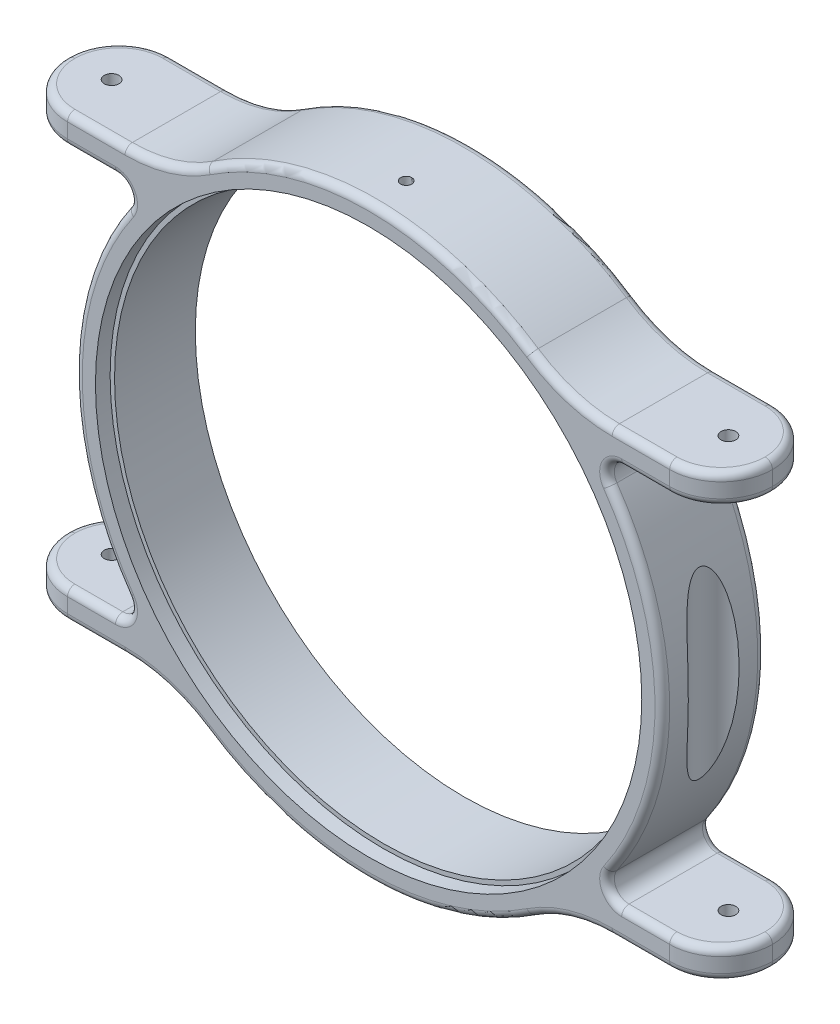
from build123d import *

# Parameters (mm, degrees)
BOSS_EXTRUDE1_DEPTH             = 2
BOSS_EXTRUDE1_DEPTH_BACK        = 5
SKETCH1_R                       = 20
SKETCH1_R_2                     = 18.3
SKETCH2_R                       = 19.3
CUT_EXTRUDE1_DEPTH              = 0.5
CUT_EXTRUDE9_DEPTH              = 34.077823777
BOSS_EXTRUDE2_REACH             = 30.723
BOSS_EXTRUDE2_DIRECTION_2_REACH = 30.723
FILLET4_R                       = 10
CUT_EXTRUDE12_DEPTH             = 32.638584118
CUT_EXTRUDE12_DEPTH_BACK        = 32.638584118
FILLET5_R                       = 1
FILLET6_R                       = 3.5
FILLET7_R                       = 0.5
CUT_EXTRUDE13_DEPTH             = 32.638584194
CUT_EXTRUDE13_DEPTH_BACK        = 32.638584194
SKETCH10_R                      = 0.5
SKETCH11_R                      = 18.6
CUT_EXTRUDE14_DEPTH             = 1
CUT_EXTRUDE16_REACH             = 43.11
SKETCH13_R                      = 2


with BuildPart() as part:
    # Sketch1 → Boss-Extrude1 (new, two sides: drawn at the far end of the back side and taken through both)
    with BuildSketch(Plane(origin=(0, 0, 0), x_dir=(-1, 0, 0), z_dir=(0, 0, -1)).offset(-BOSS_EXTRUDE1_DEPTH_BACK)):
        Circle(SKETCH1_R)
        Circle(SKETCH1_R_2, mode=Mode.SUBTRACT)
    extrude(amount=BOSS_EXTRUDE1_DEPTH + BOSS_EXTRUDE1_DEPTH_BACK)

    # Sketch2 → Cut-Extrude1 (cut)
    with BuildSketch(Plane(origin=(0, 0, -2), x_dir=(-1, 0, 0), z_dir=(0, 0, -1))):
        Circle(SKETCH2_R)
    extrude(amount=-CUT_EXTRUDE1_DEPTH, mode=Mode.SUBTRACT)

    # Sketch5 → Cut-Extrude9 (cut, through all)
    with BuildSketch(Plane(origin=(-1.350190497, 4.228871819, -2.160555979), x_dir=(1, 0, 0), z_dir=(0, 1, 0))):
        with BuildLine():
            add(Edge.make_bspline(
                [(1.350190497, -4.982788569), (1.470272407, -4.982788569), (1.590466354, -4.935768225), (1.685402744, -4.840719798), (1.779443431, -4.600555979), (1.685402744, -4.360392159), (1.590466354, -4.265343732), (1.470272407, -4.218323388), (1.350190497, -4.218323388)],
                knots=[4.921389743, 4.921389743, 4.921389743, 4.921389743, 4.921389743, 4.921389743, 7.382084615, 7.382084615, 7.382084615, 9.842779486, 9.842779486, 9.842779486, 9.842779486, 9.842779486, 9.842779486], degree=5))
            add(Edge.make_bspline(
                [(1.350190497, -4.218323388), (1.230108588, -4.218323388), (1.109914641, -4.265343732), (1.014978251, -4.360392159), (0.920937563, -4.600555979), (1.014978251, -4.840719798), (1.109914641, -4.935768225), (1.230108588, -4.982788569), (1.350190497, -4.982788569)],
                knots=[0, 0, 0, 0, 0, 0, 2.460694872, 2.460694872, 2.460694872, 4.921389743, 4.921389743, 4.921389743, 4.921389743, 4.921389743, 4.921389743], degree=5))
        make_face()
    extrude(amount=CUT_EXTRUDE9_DEPTH, mode=Mode.SUBTRACT)

    # Boss-Extrude2: up to this face of the body (flat: up to its plane)
    boss_extrude2_end = Plane(part.part.faces().sort_by_distance((19.434314575, 0, 5))[0])
    # Sketch6 → Boss-Extrude2 (add, up to the picked face)
    with BuildSketch(Plane.XY, mode=Mode.PRIVATE) as boss_extrude2_sk1:
        with BuildLine():
            ThreePointArc((-13.228756555, -15), (-20, 0), (-13.228756555, 15))
            Line((-13.228756555, 15), (-24, 15))
            Line((-24, 15), (-24, -15))
            Line((-24, -15), (-13.228756555, -15))
        make_face()
    boss_extrude2_tool1 = split(extrude(boss_extrude2_sk1.sketch, amount=BOSS_EXTRUDE2_REACH, mode=Mode.PRIVATE), bisect_by=boss_extrude2_end, keep=Keep.BOTH, mode=Mode.PRIVATE)
    # Sketch6 → Boss-Extrude2 (add, up to the picked face)
    with BuildSketch(Plane.XY, mode=Mode.PRIVATE) as boss_extrude2_sk2:
        with BuildLine():
            Line((24, 15), (13.228756555, 15))
            ThreePointArc((13.228756555, 15), (18.228756555, 8.228756555), (20, 0))
            ThreePointArc((20, 0), (18.228756555, -8.228756555), (13.228756555, -15))
            Line((13.228756555, -15), (24, -15))
            Line((24, -15), (24, 15))
        make_face()
    boss_extrude2_tool2 = split(extrude(boss_extrude2_sk2.sketch, amount=BOSS_EXTRUDE2_REACH, mode=Mode.PRIVATE), bisect_by=boss_extrude2_end, keep=Keep.BOTH, mode=Mode.PRIVATE)
    add(boss_extrude2_tool1.solids().sort_by(Axis((-20.647807, 0, 0), (0, 0, 1)))[0])
    add(boss_extrude2_tool2.solids().sort_by(Axis((20.647807, 0, 0), (0, 0, 1)))[0])

    # Boss-Extrude2 direction 2: up to this face of the body (flat: up to its plane)
    boss_extrude2_direction_2_end = Plane(part.part.faces().sort_by_distance((19.434314575, 0, -2))[0])
    # Sketch6 → Boss-Extrude2 direction 2 (add, up to the picked face)
    with BuildSketch(Plane.XY, mode=Mode.PRIVATE) as boss_extrude2_direction_2_sk1:
        with BuildLine():
            ThreePointArc((-13.228756555, -15), (-20, 0), (-13.228756555, 15))
            Line((-13.228756555, 15), (-24, 15))
            Line((-24, 15), (-24, -15))
            Line((-24, -15), (-13.228756555, -15))
        make_face()
    boss_extrude2_direction_2_tool1 = split(extrude(boss_extrude2_direction_2_sk1.sketch, amount=-BOSS_EXTRUDE2_DIRECTION_2_REACH, mode=Mode.PRIVATE), bisect_by=boss_extrude2_direction_2_end, keep=Keep.BOTH, mode=Mode.PRIVATE)
    # Sketch6 → Boss-Extrude2 direction 2 (add, up to the picked face)
    with BuildSketch(Plane.XY, mode=Mode.PRIVATE) as boss_extrude2_direction_2_sk2:
        with BuildLine():
            Line((24, 15), (13.228756555, 15))
            ThreePointArc((13.228756555, 15), (18.228756555, 8.228756555), (20, 0))
            ThreePointArc((20, 0), (18.228756555, -8.228756555), (13.228756555, -15))
            Line((13.228756555, -15), (24, -15))
            Line((24, -15), (24, 15))
        make_face()
    boss_extrude2_direction_2_tool2 = split(extrude(boss_extrude2_direction_2_sk2.sketch, amount=-BOSS_EXTRUDE2_DIRECTION_2_REACH, mode=Mode.PRIVATE), bisect_by=boss_extrude2_direction_2_end, keep=Keep.BOTH, mode=Mode.PRIVATE)
    add(boss_extrude2_direction_2_tool1.solids().sort_by(Axis((-20.647807, 0, 0), (0, 0, -1)))[0])
    add(boss_extrude2_direction_2_tool2.solids().sort_by(Axis((20.647807, 0, 0), (0, 0, -1)))[0])

    # Fillet4
    fillet4_edges = [part.edges().sort_by_distance(p)[0] for p in [
        (-13.228756555, 15, 1.5),
        (-13.228756555, -15, 1.5),
        (13.228756555, 15, 1.5),
        (13.228756555, -15, 1.5),
    ]]
    fillet(fillet4_edges, radius=FILLET4_R)

    # Sketch9 → Cut-Extrude12 (cut, two sides: drawn at the far end of the back side and taken through both)
    with BuildSketch(Plane.XY.offset(-CUT_EXTRUDE12_DEPTH_BACK)):
        with BuildLine():
            Line((24, -13), (24, 13))
            Line((24, 13), (16.583123952, 13))
            Line((16.583123952, 13), (15.198684154, 13))
            ThreePointArc((15.198684154, 13), (20, 0), (15.198684154, -13))
            Line((15.198684154, -13), (16.583123952, -13))
            Line((16.583123952, -13), (24, -13))
        make_face()
        with BuildLine():
            Line((-15.198684154, 13), (-16.583123952, 13))
            Line((-16.583123952, 13), (-24, 13))
            Line((-24, 13), (-24, -13))
            Line((-24, -13), (-16.583123952, -13))
            Line((-16.583123952, -13), (-15.198684154, -13))
            ThreePointArc((-15.198684154, -13), (-20, 0), (-15.198684154, 13))
        make_face()
    extrude(amount=CUT_EXTRUDE12_DEPTH + CUT_EXTRUDE12_DEPTH_BACK, mode=Mode.SUBTRACT)

    # Fillet5
    fillet5_edges = [part.edges().sort_by_distance(p)[0] for p in [
        (-15.198684154, 13, 1.5),
        (-15.198684154, -13, 1.5),
        (15.198684154, -13, 1.5),
        (15.198684154, 13, 1.5),
    ]]
    fillet(fillet5_edges, radius=FILLET5_R)

    # Fillet6
    fillet6_edges = [part.edges().sort_by_distance(p)[0] for p in [
        (-24, 14, 5),
        (-24, 14, -2),
        (-24, -14, 5),
        (-24, -14, -2),
        (24, -14, 5),
        (24, -14, -2),
        (24, 14, 5),
        (24, 14, -2),
    ]]
    fillet(fillet6_edges, radius=FILLET6_R - 0.0001)  # a hair under: the kernel refuses the full size

    # Fillet7
    fillet7_edges = [part.edges().sort_by_distance(p)[0] for p in [
        (20, 0, -2),
        (20, 0, 5),
        (-20, 0, -2),
        (-20, 0, 5),
        (-18.86689397, -13, -2),
        (-18.86689397, -13, 5),
        (-18.86689397, 13, -2),
        (-18.86689397, 13, 5),
        (16.347282679, 12.46291005, 5),
        (16.347282679, 12.46291005, -2),
        (16.347282679, -12.46291005, 5),
        (16.347282679, -12.46291005, -2),
        (-16.347282679, -12.46291005, 5),
        (-16.347282679, -12.46291005, -2),
        (-16.347282679, 12.46291005, 5),
        (-16.347282679, 12.46291005, -2),
        (-18.541611976, 15, -2),
        (-22.974903023, 15, -0.974903023),
        (-22.974903023, 15, 3.974903023),
        (18.541611976, -15, 5),
        (18.86689397, -13, 5),
        (18.86689397, 13, 5),
        (18.541611976, 15, 5),
        (-22.974903023, 13, -0.974903023),
        (-22.974903023, 13, 3.974903023),
        (18.86689397, 13, -2),
        (18.86689397, -13, -2),
        (-18.541611976, -15, -2),
        (-22.974903023, -13, -0.974903023),
        (-22.974903023, -13, 3.974903023),
        (-22.974903023, -15, -0.974903023),
        (-22.974903023, -15, 3.974903023),
        (22.974903023, -13, -0.974903023),
        (22.974903023, -13, 3.974903023),
        (22.974903023, -15, -0.974903023),
        (22.974903023, -15, 3.974903023),
        (22.974903023, 15, -0.974903023),
        (22.974903023, 15, 3.974903023),
        (22.974903023, 13, -0.974903023),
        (22.974903023, 13, 3.974903023),
        (18.541611976, -15, -2),
        (0, -20, 5),
        (0, -20, -2),
        (0, 20, 5),
        (0, 20, -2),
        (18.541611976, 15, -2),
        (-18.541611976, -15, 5),
        (-18.541611976, 15, 5),
        (13.696372606, -15.425728922, -2),
        (13.696372606, -15.425728922, 5),
        (13.696372606, 15.425728922, -2),
        (13.696372606, 15.425728922, 5),
        (-13.696372606, -15.425728922, -2),
        (-13.696372606, -15.425728922, 5),
        (-13.696372606, 15.425728922, -2),
        (-13.696372606, 15.425728922, 5),
    ]]
    fillet(fillet7_edges, radius=FILLET7_R)

    # Sketch10 → Cut-Extrude13 (cut, two sides: drawn at the far end of the back side and taken through both)
    with BuildSketch(Plane(origin=(0, 0, 0), x_dir=(1, 0, 0), z_dir=(0, 1, 0)).offset(-CUT_EXTRUDE13_DEPTH_BACK)):
        with Locations(Location((-21, -1.5, 0), (0, 0, 270))):
            Circle(SKETCH10_R)
        with Locations(Location((21, -1.5, 0), (0, 0, 270))):
            Circle(SKETCH10_R)
    extrude(amount=CUT_EXTRUDE13_DEPTH + CUT_EXTRUDE13_DEPTH_BACK, mode=Mode.SUBTRACT)

    # Sketch11 → Cut-Extrude14 (cut)
    with BuildSketch(Plane.XY.offset(5)):
        Circle(SKETCH11_R)
    extrude(amount=-CUT_EXTRUDE14_DEPTH, mode=Mode.SUBTRACT)

    # Cut-Extrude16: up to this face of the body (flat: up to its plane)
    cut_extrude16_end = Plane(part.part.faces().sort_by_distance((20.063016295, -13, 1.5))[0])
    # Sketch13 → Cut-Extrude16 (cut, up to the picked face)
    with BuildSketch(Plane.XZ.offset(-13), mode=Mode.PRIVATE) as cut_extrude16_sk1:
        with Locations((21, 1.5)):
            Circle(SKETCH13_R)
    cut_extrude16_tool1 = split(extrude(cut_extrude16_sk1.sketch, amount=CUT_EXTRUDE16_REACH, mode=Mode.PRIVATE), bisect_by=cut_extrude16_end, keep=Keep.BOTH, mode=Mode.PRIVATE)
    # Sketch13 → Cut-Extrude16 (cut, up to the picked face)
    with BuildSketch(Plane.XZ.offset(-13), mode=Mode.PRIVATE) as cut_extrude16_sk2:
        with Locations((-21, 1.5)):
            Circle(SKETCH13_R)
    cut_extrude16_tool2 = split(extrude(cut_extrude16_sk2.sketch, amount=CUT_EXTRUDE16_REACH, mode=Mode.PRIVATE), bisect_by=cut_extrude16_end, keep=Keep.BOTH, mode=Mode.PRIVATE)
    add(cut_extrude16_tool1.solids().sort_by(Axis((21, 13, 1.5), (0, -1, 0)))[0], mode=Mode.SUBTRACT)
    add(cut_extrude16_tool2.solids().sort_by(Axis((-21, 13, 1.5), (0, -1, 0)))[0], mode=Mode.SUBTRACT)


solid = part.part
